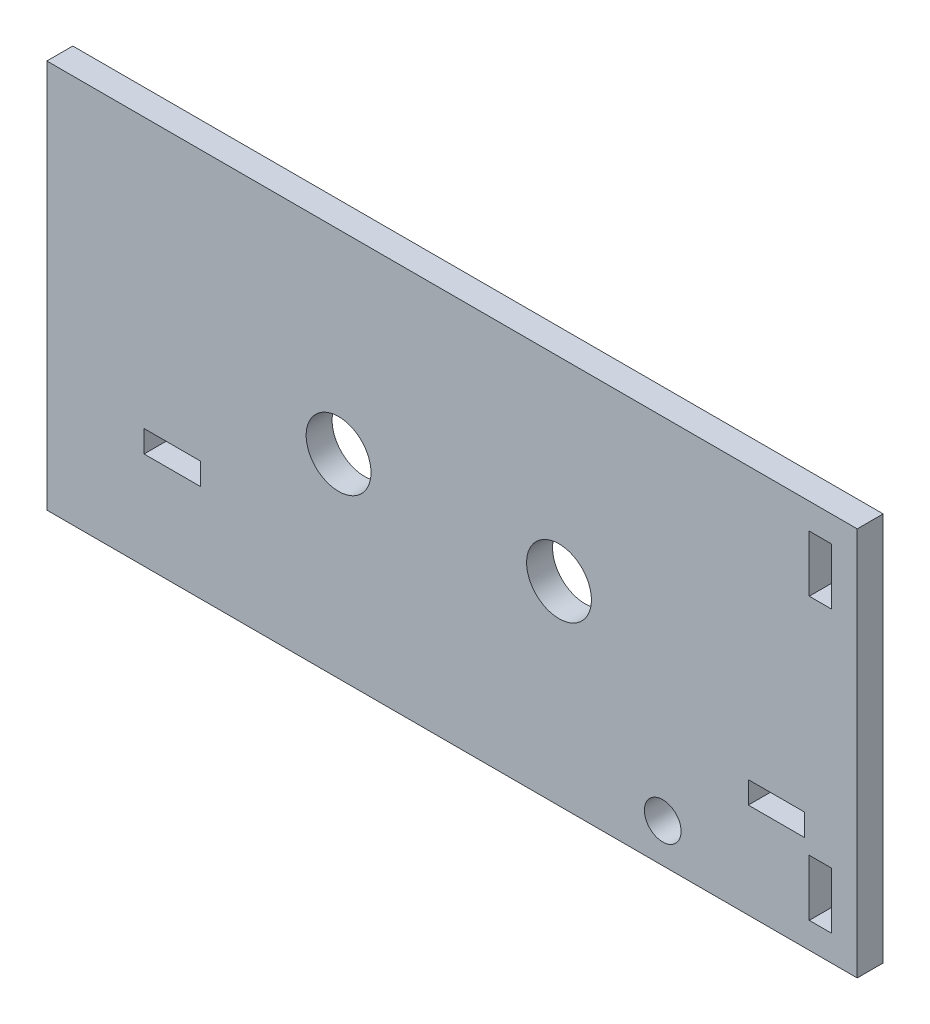
from build123d import *

# Parameters (mm, degrees)
SKETCH1_W               = 121
SKETCH1_H               = 60
SKETCH1_R               = 5
SKETCH1_R_2             = 2.83
SKETCH1_W_2             = 8.7
SKETCH1_H_2             = 3.4
BOSS_EXTRUDE1_DEPTH     = 4
SKETCH2_W               = 4
SKETCH2_H               = 60
BOSS_EXTRUDE2_DEPTH     = 4
CUT_EXTRUDE2_DEPTH      = 90.374962565
CUT_EXTRUDE2_DEPTH_BACK = 90.374962565
SKETCH3_W               = 3.4
SKETCH3_H               = 8.7


with BuildPart() as part:
    # Sketch1 → Boss-Extrude1 (new body)
    with BuildSketch(Plane.XY):
        with Locations((-18.5, 11.603893248)):
            Rectangle(SKETCH1_W, SKETCH1_H)
        with Locations((-34, 11.603893248)):
            Circle(SKETCH1_R, mode=Mode.SUBTRACT)
        with Locations((0, 11.603893248)):
            Circle(SKETCH1_R, mode=Mode.SUBTRACT)
        with Locations((16, -12.396106752)):
            Circle(SKETCH1_R_2, mode=Mode.SUBTRACT)
        with Locations((-59.65, -1.696106752)):
            Rectangle(SKETCH1_W_2, SKETCH1_H_2, mode=Mode.SUBTRACT)
        with Locations((33.55, -1.996106752)):
            Rectangle(SKETCH1_W_2, SKETCH1_H_2, mode=Mode.SUBTRACT)
    extrude(amount=BOSS_EXTRUDE1_DEPTH)

    # Sketch2 → Boss-Extrude2 (add)
    with BuildSketch(Plane.XY):
        with Locations((44, 11.603893248)):
            Rectangle(SKETCH2_W, SKETCH2_H)
    extrude(amount=BOSS_EXTRUDE2_DEPTH)

    # Sketch3 → Cut-Extrude2 (cut, two sides: drawn at the far end of the back side and taken through both)
    with BuildSketch(Plane.XY.offset(-CUT_EXTRUDE2_DEPTH_BACK)):
        with Locations((40.3, 33.253893248)):
            Rectangle(SKETCH3_W, SKETCH3_H)
        with Locations((40.3, -10.046106752)):
            Rectangle(SKETCH3_W, SKETCH3_H)
    extrude(amount=CUT_EXTRUDE2_DEPTH + CUT_EXTRUDE2_DEPTH_BACK, mode=Mode.SUBTRACT)


solid = part.part
